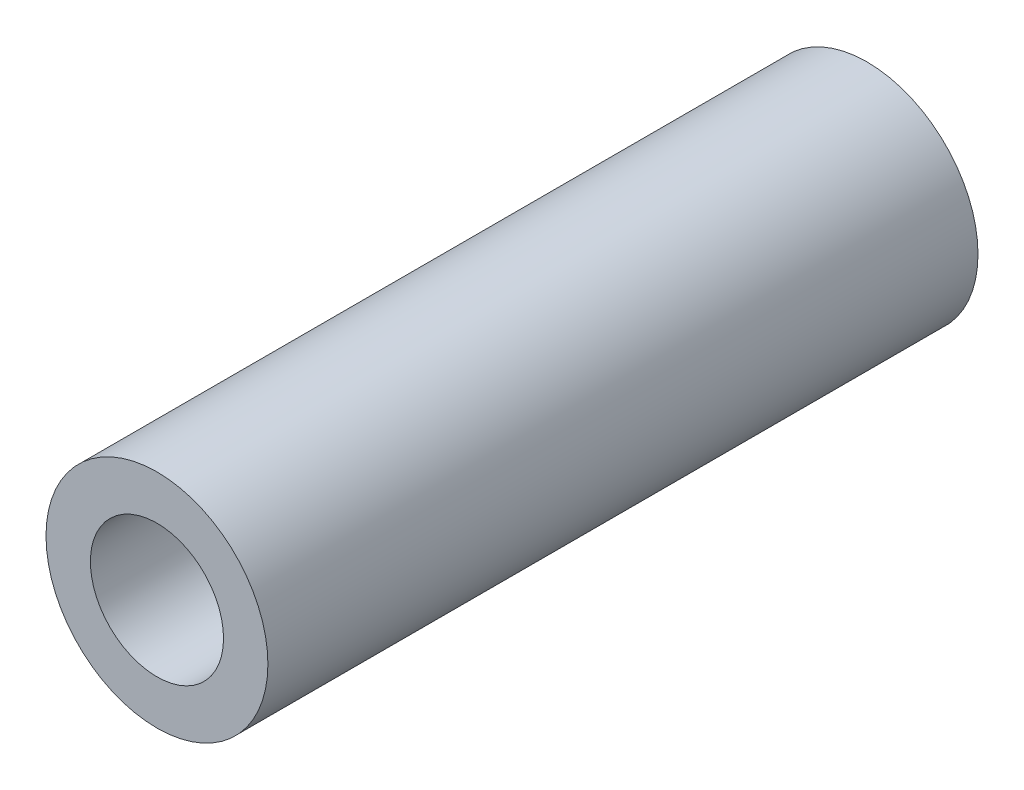
from build123d import *

# Parameters (mm, degrees)
ESBO_O1_R                = 5
ESBO_O1_R_2              = 3
RESSALTO_EXTRUS_O1_DEPTH = 32


with BuildPart() as part:
    # Esboço1 → Ressalto-extrusão1 (new body)
    with BuildSketch(Plane.XY):
        Circle(ESBO_O1_R)
        Circle(ESBO_O1_R_2, mode=Mode.SUBTRACT)
    extrude(amount=RESSALTO_EXTRUS_O1_DEPTH)


solid = part.part
